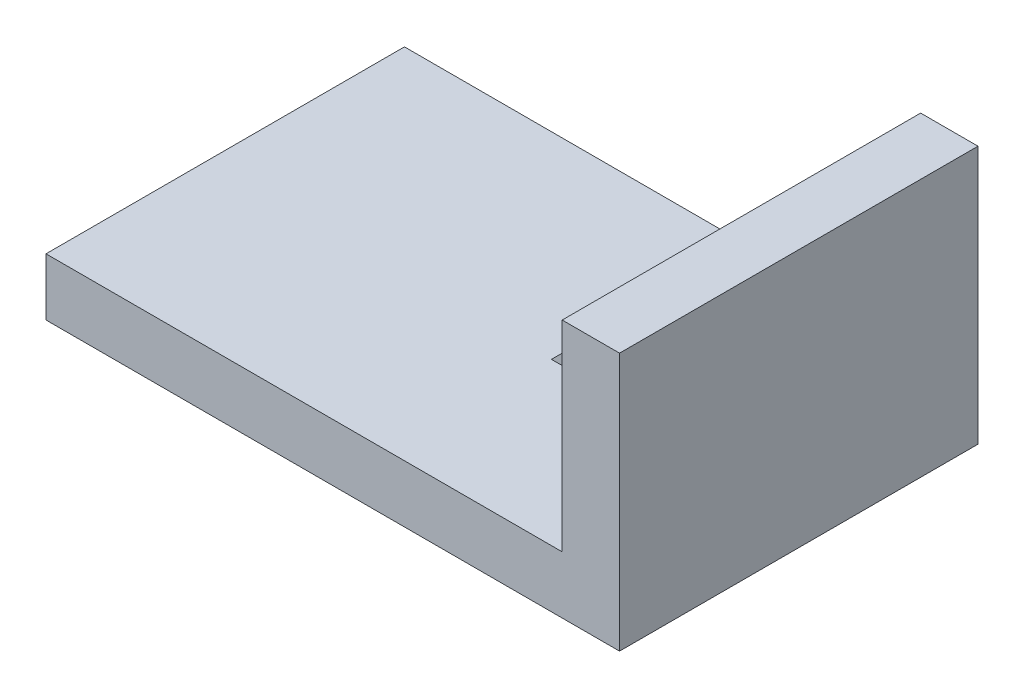
from build123d import *

# Parameters (mm, degrees)
EXTRUDE_1_DEPTH = 50
EXTRUDE_START   = -2.5
EXTRUDE_2_DEPTH = 5


# Read off the part's stored shape, not the designer's step: 凸台-拉伸2
with BuildPart() as part:
    # 草图1 → 凸台-拉伸1 (new body)
    with BuildSketch(Plane.XY.offset(-25)):
        Polygon((-40, 0), (40, 0), (40, 36), (32, 36), (32, 8), (-40, 8), align=None)
    extrude(amount=EXTRUDE_1_DEPTH)

    # 凸台-拉伸2 outline → 凸台-拉伸2 (add)
    with BuildSketch(Plane.XY.offset(EXTRUDE_START)):
        Polygon((32, 32), (8, 8), (32, 8), align=None)
    extrude(amount=EXTRUDE_2_DEPTH)


solid = part.part
